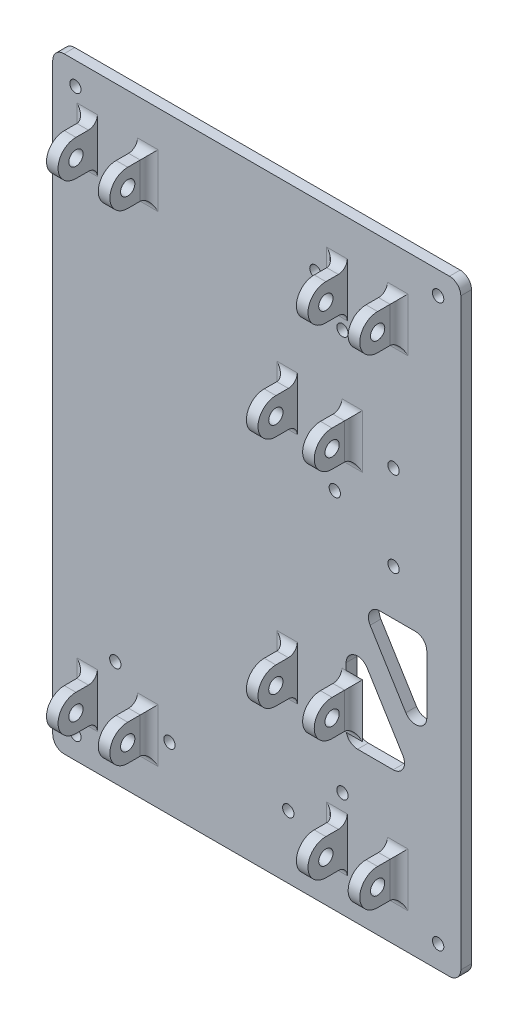
from build123d import *

# Parameters (mm, degrees)
SKETCH1_W               = 228.6
SKETCH1_H               = 339.725
BOSS_EXTRUDE1_DEPTH     = 6
SKETCH2_W               = 6.5
SKETCH2_H               = 20
BOSS_EXTRUDE2_DEPTH     = 24
CUT_EXTRUDE1_DEPTH      = 401.568453108
CUT_EXTRUDE1_DEPTH_BACK = 401.568453108
SKETCH3_R               = 4
FILLET2_R               = 5
SKETCH5_R               = 3.175
CUT_EXTRUDE2_DEPTH      = 411.067111123
CUT_EXTRUDE3_DEPTH      = 411.067111123
FILLET4_R               = 6.35


with BuildPart() as part:
    # Sketch1 → Boss-Extrude1 (new body)
    with BuildSketch(Plane.XY):
        with Locations((114.3, -169.8625)):
            Rectangle(SKETCH1_W, SKETCH1_H)
    extrude(amount=BOSS_EXTRUDE1_DEPTH)

    # Sketch2 → Boss-Extrude2 (add)
    with BuildSketch(Plane.XY.offset(6)):
        with Locations((21.75, -35.2425)):
            Rectangle(SKETCH2_W, SKETCH2_H)
        with Locations((50.75, -35.2425)):
            Rectangle(SKETCH2_W, SKETCH2_H)
        with Locations((190.75, -35.2425)):
            Rectangle(SKETCH2_W, SKETCH2_H)
        with Locations((161.75, -35.2425)):
            Rectangle(SKETCH2_W, SKETCH2_H)
        with Locations((133.75, -104.5325)):
            Rectangle(SKETCH2_W, SKETCH2_H)
        with Locations((165.25, -104.5325)):
            Rectangle(SKETCH2_W, SKETCH2_H)
        with Locations((165.25, -235.1925)):
            Rectangle(SKETCH2_W, SKETCH2_H)
        with Locations((21.75, -304.4825)):
            Rectangle(SKETCH2_W, SKETCH2_H)
        with Locations((50.75, -304.4825)):
            Rectangle(SKETCH2_W, SKETCH2_H)
        with Locations((190.75, -304.4825)):
            Rectangle(SKETCH2_W, SKETCH2_H)
        with Locations((161.75, -304.4825)):
            Rectangle(SKETCH2_W, SKETCH2_H)
        with Locations((133.75, -235.1925)):
            Rectangle(SKETCH2_W, SKETCH2_H)
    extrude(amount=BOSS_EXTRUDE2_DEPTH)

    # Sketch3 → Cut-Extrude1 (cut, two sides: drawn at the far end of the back side and taken through both)
    with BuildSketch(Plane.ZY.offset(-18.5).offset(-CUT_EXTRUDE1_DEPTH_BACK)):
        with Locations(Location((18, -35.2425, 0), (0, 0, 270))):
            Circle(SKETCH3_R)
        with Locations(Location((18, -235.1925, 0), (0, 0, 270))):
            Circle(SKETCH3_R)
        with Locations(Location((18, -304.4825, 0), (0, 0, 270))):
            Circle(SKETCH3_R)
        with Locations(Location((18, -104.5325, 0), (0, 0, 270))):
            Circle(SKETCH3_R)
        with BuildLine():
            Line((18, -25.2425), (18, -12.982943413))
            Line((18, -12.982943413), (51.949532367, -12.982943413))
            Line((51.949532367, -12.982943413), (51.949532367, -57.481006387))
            Line((51.949532367, -57.481006387), (18, -57.481006387))
            Line((18, -57.481006387), (18, -45.2425))
            ThreePointArc((18, -45.2425), (28, -35.2425), (18, -25.2425))
        make_face()
        with BuildLine():
            Line((52.442304634, -132.399123951), (18, -132.399123951))
            Line((18, -132.399123951), (18, -114.5325))
            ThreePointArc((18, -114.5325), (28, -104.5325), (18, -94.5325))
            Line((18, -94.5325), (18, -71.59149594))
            Line((18, -71.59149594), (52.442304634, -71.59149594))
            Line((52.442304634, -71.59149594), (52.442304634, -132.399123951))
        make_face()
        with BuildLine():
            Line((52.599532243, -270.375386727), (18, -270.375386727))
            Line((18, -270.375386727), (18, -245.1925))
            ThreePointArc((18, -245.1925), (28, -235.1925), (18, -225.1925))
            Line((18, -225.1925), (18, -207.306351849))
            Line((18, -207.306351849), (52.599532243, -207.306351849))
            Line((52.599532243, -207.306351849), (52.599532243, -270.375386727))
        make_face()
        with BuildLine():
            Line((52.621034016, -326.721115515), (18, -326.721115515))
            Line((18, -326.721115515), (18, -314.4825))
            ThreePointArc((18, -314.4825), (28, -304.4825), (18, -294.4825))
            Line((18, -294.4825), (18, -282.222834285))
            Line((18, -282.222834285), (52.621034016, -282.222834285))
            Line((52.621034016, -282.222834285), (52.621034016, -326.721115515))
        make_face()
    extrude(amount=CUT_EXTRUDE1_DEPTH + CUT_EXTRUDE1_DEPTH_BACK, mode=Mode.SUBTRACT)

    # Fillet2
    fillet2_edges = [part.edges().sort_by_distance(p)[0] for p in [
        (190.75, -45.2425, 6),
        (194, -35.2425, 6),
        (190.75, -25.2425, 6),
        (50.75, -45.2425, 6),
        (54, -35.2425, 6),
        (50.75, -25.2425, 6),
        (21.75, -25.2425, 6),
        (18.5, -35.2425, 6),
        (21.75, -45.2425, 6),
        (161.75, -25.2425, 6),
        (158.5, -35.2425, 6),
        (161.75, -45.2425, 6),
        (161.75, -294.4825, 6),
        (161.75, -314.4825, 6),
        (158.5, -304.4825, 6),
        (190.75, -314.4825, 6),
        (194, -304.4825, 6),
        (190.75, -294.4825, 6),
        (165.25, -245.1925, 6),
        (168.5, -235.1925, 6),
        (165.25, -225.1925, 6),
        (133.75, -225.1925, 6),
        (130.5, -235.1925, 6),
        (133.75, -245.1925, 6),
        (50.75, -314.4825, 6),
        (54, -304.4825, 6),
        (50.75, -294.4825, 6),
        (21.75, -294.4825, 6),
        (21.75, -314.4825, 6),
        (18.5, -304.4825, 6),
        (165.25, -114.5325, 6),
        (165.25, -94.5325, 6),
        (168.5, -104.5325, 6),
        (133.75, -94.5325, 6),
        (130.5, -104.5325, 6),
        (133.75, -114.5325, 6),
    ]]
    fillet(fillet2_edges, radius=FILLET2_R)

    # Sketch5 → Cut-Extrude2 (cut, through all)
    with BuildSketch(Plane.XY.offset(6)):
        with Locations((12.7, -12.7)):
            Circle(SKETCH5_R)
        with Locations((34.925, -56.5925)):
            Circle(SKETCH5_R)
        with Locations((147.15, -35.2425)):
            Circle(SKETCH5_R)
        with Locations((215.9, -12.7)):
            Circle(SKETCH5_R)
        with Locations((162.306, -56.1175)):
            Circle(SKETCH5_R)
        with Locations((190.92, -108.713)):
            Circle(SKETCH5_R)
        with Locations((158.028, -136.132936151)):
            Circle(SKETCH5_R)
        with Locations((190.92, -156.463)):
            Circle(SKETCH5_R)
        with Locations((215.9, -327.025)):
            Circle(SKETCH5_R)
        with Locations((162.306, -280.6075)):
            Circle(SKETCH5_R)
        with Locations((131.954, -304.4825)):
            Circle(SKETCH5_R)
        with Locations((65.404, -304.4825)):
            Circle(SKETCH5_R)
        with Locations((35.052, -280.6075)):
            Circle(SKETCH5_R)
        with Locations((12.7, -327.025)):
            Circle(SKETCH5_R)
    extrude(amount=-CUT_EXTRUDE2_DEPTH, mode=Mode.SUBTRACT)

    # Sketch9 → Cut-Extrude3 (cut, through all)
    with BuildSketch(Plane.XY.offset(6)):
        Polygon((202.092282323, -255.2075), (164.378, -193.971885464), (164.378, -255.2075), align=None)
        Polygon((209.55, -181.863), (171.835717677, -181.863), (209.55, -243.098614536), align=None)
    extrude(amount=-CUT_EXTRUDE3_DEPTH, mode=Mode.SUBTRACT)

    # Fillet4
    # the kernel refuses this fillet: 6.35 mm, written as the material it adds along each edge
    with BuildSketch(Plane(origin=(171.835717677, -181.863, 6), x_dir=(0.524408296598249, -0.8514669332739371, 0), z_dir=(0, 0, -1)), Plane(origin=(202.092282323, -255.2075, 6), x_dir=(-0.524408296598249, 0.8514669332739371, 0), z_dir=(0, 0, -1))) as fillet4_piece_1:
        with BuildLine():
            CenterArc((FILLET4_R * 1.79033176396, -FILLET4_R), FILLET4_R, 90, 121.628418608)
            Line((FILLET4_R * 0.938864830682, -FILLET4_R * 1.5244082966), (0, 0))
            Line((0, 0), (FILLET4_R * 1.79033176396, 0))
        make_face()
    extrude(amount=6)
    with BuildSketch(Plane(origin=(209.55, -181.863, 6), x_dir=(0, -1, 0), z_dir=(0, 0, -1)), Plane(origin=(164.378, -255.2075, 6), x_dir=(0, 1, 0), z_dir=(0, 0, -1))) as fillet4_piece_2:
        with BuildLine():
            CenterArc((FILLET4_R, FILLET4_R), FILLET4_R, 180, 90)
            Line((0, FILLET4_R), (0, 0))
            Line((0, 0), (FILLET4_R, 0))
        make_face()
    extrude(amount=6)
    with BuildSketch(Plane(origin=(209.55, -243.098614536, 6), x_dir=(0, 1, 0), z_dir=(0, 0, -1)), Plane(origin=(164.378, -193.971885464, 6), x_dir=(0, -1, 0), z_dir=(0, 0, -1))) as fillet4_piece_3:
        with BuildLine():
            CenterArc((FILLET4_R * 3.53058284029, -FILLET4_R), FILLET4_R, 90, 148.371581392)
            Line((FILLET4_R * 3.00617454369, -FILLET4_R * 1.85146693327), (0, 0))
            Line((0, 0), (FILLET4_R * 3.53058284029, 0))
        make_face()
    extrude(amount=6)
    # the kernel refuses this fillet: 6.35 mm, written as the material it takes off along each edge
    with BuildSketch(Plane(origin=(0, 0, -15.875), x_dir=(0, -1, 0), z_dir=(0, 0, 1))) as fillet4_2_piece_1:
        with BuildLine():
            CenterArc((FILLET4_R, FILLET4_R), FILLET4_R, 180, 90)
            Line((0, FILLET4_R), (0, 0))
            Line((0, 0), (FILLET4_R, 0))
        make_face()
    extrude(amount=37.75, mode=Mode.SUBTRACT)
    with BuildSketch(Plane(origin=(228.6, 0, -15.875), x_dir=(0, -1, 0), z_dir=(0, 0, 1)), Plane(origin=(228.6, -339.725, -15.875), x_dir=(-1, 0, 0), z_dir=(0, 0, 1)), Plane(origin=(0, -339.725, -15.875), x_dir=(0, 1, 0), z_dir=(0, 0, 1))) as fillet4_2_piece_2:
        with BuildLine():
            CenterArc((FILLET4_R, -FILLET4_R), FILLET4_R, 90, 90)
            Line((0, -FILLET4_R), (0, 0))
            Line((0, 0), (FILLET4_R, 0))
        make_face()
    extrude(amount=37.75, mode=Mode.SUBTRACT)


solid = part.part
